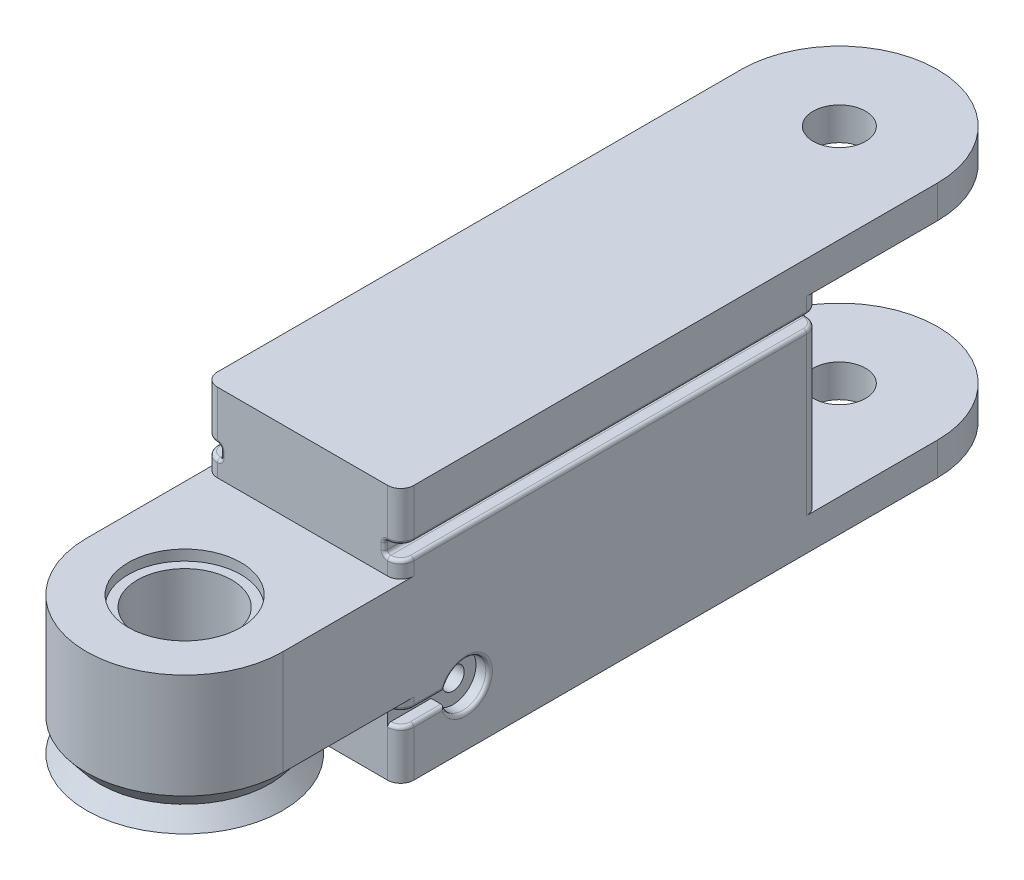
from build123d import *

# Parameters (mm, degrees)
EXTRUDE_1_DEPTH          = 8
EXTRUDE_2_DEPTH          = 5.5
EXTRUDE_2_DEPTH_BACK     = 14
CUT_EXTRUDE_1_DEPTH      = 11.5
CUT_EXTRUDE_1_DEPTH_BACK = 3
FILLET_1_R               = 1
SKETCH_5_W               = 1
SKETCH_5_H               = 1
CUT_EXTRUDE_2_DEPTH      = 5
CUT_EXTRUDE_3_REACH      = 63.051
SKETCH_6_R               = 0.5
SKETCH_7_R               = 1.75
CUT_EXTRUDE_4_DEPTH      = 1
CUT_EXTRUDE_START        = -1
SKETCH_8_R               = 1.75
CUT_EXTRUDE_5_DEPTH      = 1
CUT_EXTRUDE_6_REACH      = 53.034
SKETCH_9_W               = 1.25
SKETCH_9_H               = 1
FILLET_2_R               = 0.25
SKETCH_10_R              = 2
CUT_EXTRUDE_7_DEPTH      = 10.5
CUT_EXTRUDE_8_REACH      = 63.178
SKETCH_11_R              = 2
SKETCH_12_R              = 3.6
CUT_EXTRUDE_9_DEPTH      = 10.5
SKETCH_13_R              = 4.3
CUT_EXTRUDE_10_DEPTH     = 0.8
CUT_EXTRUDE_START_2      = -0.8
SKETCH_14_R              = 4.3
CUT_EXTRUDE_11_DEPTH     = 0.8
SKETCH_15_R              = 0.85
CUT_EXTRUDE_12_DEPTH     = 13


with BuildPart() as part:
    # 스케치1 → 보스-돌출1 (new body)
    with BuildSketch(Plane(origin=(0, 0, 0), x_dir=(1, 0, 0), z_dir=(0, 1, 0))):
        with BuildLine():
            Line((-7.5, 0), (-7.5, 50))
            ThreePointArc((-7.5, 50), (0, 57.5), (7.5, 50))
            Line((7.5, 50), (7.5, 0))
            ThreePointArc((7.5, 0), (0, -7.5), (-7.5, 0))
        make_face()
    extrude(amount=EXTRUDE_1_DEPTH)

    # 스케치2 → 회전1 (revolve)
    with BuildSketch(Plane.XY, mode=Mode.PRIVATE) as revolve_1_sk:
        Polygon((0, 0), (0, -2.5), (-7.5, -2.5), (-6.5, -1.25), (-7.5, 0), align=None)
    revolve(revolve_1_sk.sketch.rotate(Axis((0, 0, 0), (0, -1, 0)), 270), axis=Axis((0, 0, 0), (0, -1, 0)))

    # 스케치3 → 보스-돌출2 (add, two sides: drawn at the far end of the back side and taken through both)
    with BuildSketch(Plane.XZ.offset(-EXTRUDE_2_DEPTH_BACK)):
        with BuildLine():
            Line((7.5, -50), (7.5, -9))
            Line((7.5, -9), (-7.5, -9))
            Line((-7.5, -9), (-7.5, -50))
            ThreePointArc((-7.5, -50), (0, -57.5), (7.5, -50))
        make_face()
    extrude(amount=EXTRUDE_2_DEPTH + EXTRUDE_2_DEPTH_BACK)

    # 스케치4 → 컷-돌출1 (cut, two sides: drawn at the far end of the back side and taken through both)
    with BuildSketch(Plane(origin=(0, 0, 0), x_dir=(1, 0, 0), z_dir=(0, 1, 0)).offset(-CUT_EXTRUDE_1_DEPTH_BACK)):
        with BuildLine():
            Line((-7.5, 50), (-7.5, 41))
            Line((-7.5, 41), (7.5, 41))
            Line((7.5, 41), (7.5, 50))
            ThreePointArc((7.5, 50), (0, 57.5), (-7.5, 50))
        make_face()
    extrude(amount=CUT_EXTRUDE_1_DEPTH + CUT_EXTRUDE_1_DEPTH_BACK, mode=Mode.SUBTRACT)

    # 필렛1
    fillet_1_edges = [part.edges().sort_by_distance(p)[0] for p in [
        (7.5, -2.75, -9),
        (-7.5, -2.75, -9),
        (7.5, 11, -9),
        (-7.5, 11, -9),
        (-7.5, 4.25, -41),
        (7.5, 4.25, -41),
    ]]
    fillet(fillet_1_edges, radius=FILLET_1_R)

    # 스케치5 → 컷-돌출2 (cut)
    with BuildSketch(Plane.XY.offset(-9)):
        with Locations((-7, -1.25)):
            Rectangle(SKETCH_5_W, SKETCH_5_H)
        with Locations((7, -1.25)):
            Rectangle(SKETCH_5_W, SKETCH_5_H)
    extrude(amount=-CUT_EXTRUDE_2_DEPTH, mode=Mode.SUBTRACT)

    # 컷-돌출3: up to this face of the body (flat: up to its plane)
    cut_extrude_3_end = Plane(part.part.faces().sort_by_distance((-7.5, 4.25281294, -24.229254571))[0])
    # 스케치6 → 컷-돌출3 (cut, up to the picked face)
    with BuildSketch(Plane(origin=(7.5, 0, 0), x_dir=(0, 0, -1), z_dir=(1, 0, 0)), mode=Mode.PRIVATE) as cut_extrude_3_sk1:
        with Locations(Location((14, -1.25, 0), (0, 0, 90))):
            Circle(SKETCH_6_R)
    cut_extrude_3_tool1 = split(extrude(cut_extrude_3_sk1.sketch, amount=-CUT_EXTRUDE_3_REACH, mode=Mode.PRIVATE), bisect_by=cut_extrude_3_end, keep=Keep.BOTH, mode=Mode.PRIVATE)
    add(cut_extrude_3_tool1.solids().sort_by(Axis((7.5, -1.25, -14), (-1, 0, 0)))[0], mode=Mode.SUBTRACT)

    # 스케치7 → 컷-돌출4 (cut)
    with BuildSketch(Plane(origin=(7.5, 0, 0), x_dir=(0, 0, -1), z_dir=(1, 0, 0))):
        with Locations((14, -1.25)):
            Circle(SKETCH_7_R)
    extrude(amount=-CUT_EXTRUDE_4_DEPTH, mode=Mode.SUBTRACT)

    # 스케치8 → 컷-돌출5 (cut)
    with BuildSketch(Plane.ZY.offset(7.5).offset(CUT_EXTRUDE_START)):
        with Locations((-14, -1.25)):
            Circle(SKETCH_8_R)
    extrude(amount=CUT_EXTRUDE_5_DEPTH, mode=Mode.SUBTRACT)

    # 컷-돌출6: up to this face of the body (flat: up to its plane)
    cut_extrude_6_end = Plane(part.part.faces().sort_by_distance((0, 4.25, -41))[0])
    # 스케치9 → 컷-돌출6 (cut, up to the picked face)
    with BuildSketch(Plane.XY.offset(-9), mode=Mode.PRIVATE) as cut_extrude_6_sk1:
        with Locations((6.875, 9.75)):
            Rectangle(SKETCH_9_W, SKETCH_9_H)
    cut_extrude_6_tool1 = split(extrude(cut_extrude_6_sk1.sketch, amount=-CUT_EXTRUDE_6_REACH, mode=Mode.PRIVATE), bisect_by=cut_extrude_6_end, keep=Keep.BOTH, mode=Mode.PRIVATE)
    # 스케치9 → 컷-돌출6 (cut, up to the picked face)
    with BuildSketch(Plane.XY.offset(-9), mode=Mode.PRIVATE) as cut_extrude_6_sk2:
        with Locations((-6.875, 9.75)):
            Rectangle(SKETCH_9_W, SKETCH_9_H)
    cut_extrude_6_tool2 = split(extrude(cut_extrude_6_sk2.sketch, amount=-CUT_EXTRUDE_6_REACH, mode=Mode.PRIVATE), bisect_by=cut_extrude_6_end, keep=Keep.BOTH, mode=Mode.PRIVATE)
    add(cut_extrude_6_tool1.solids().sort_by(Axis((6.875, 9.75, -9), (0, 0, -1)))[0], mode=Mode.SUBTRACT)
    add(cut_extrude_6_tool2.solids().sort_by(Axis((-6.875, 9.75, -9), (0, 0, -1)))[0], mode=Mode.SUBTRACT)

    # 필렛2
    fillet_2_edges = [part.edges().sort_by_distance(p)[0] for p in [
        (7.207106781, 9.25, -40.707106781),
        (7.207106781, 9.25, -9.292893219),
        (7.207106781, 10.25, -40.707106781),
        (7.207106781, 10.25, -9.292893219),
        (7.207106781, -1.75, -9.292893219),
        (7.207106781, -0.75, -9.292893219),
        (-7.207106781, 10.25, -40.707106781),
        (-7.207106781, 10.25, -9.292893219),
        (-7.207106781, 9.25, -40.707106781),
        (-7.207106781, 9.25, -9.292893219),
        (-7.207106781, -1.75, -9.292893219),
        (-7.207106781, -0.75, -9.292893219),
        (7.5, 9.25, -25),
        (7.5, 10.25, -25),
        (7.5, -1.25, -15.75),
        (7.5, -1.75, -11.161474508),
        (7.5, -0.75, -11.161474508),
        (-7.5, 10.25, -25),
        (-7.5, 9.25, -25),
        (-7.5, -1.25, -15.75),
        (-7.5, -1.75, -11.161474508),
        (-7.5, -0.75, -11.161474508),
        (6.25, 9.75, -41),
        (6.25, 9.75, -9),
        (-6.25, 9.75, -41),
        (-6.25, 9.75, -9),
        (-6.25, 9.25, -25),
        (6.25, 10.25, -25),
        (6.25, 9.25, -25),
        (-6.25, 10.25, -25),
    ]]
    fillet(fillet_2_edges, radius=FILLET_2_R - 0.0001)  # a hair under: the kernel refuses the full size

    # 스케치10 → 컷-돌출7 (cut)
    with BuildSketch(Plane.XZ.offset(2.5)):
        with Locations(Location((0, 0, 0), (0, 0, 270))):
            Circle(SKETCH_10_R)
    extrude(amount=-CUT_EXTRUDE_7_DEPTH, mode=Mode.SUBTRACT)

    # 컷-돌출8: up to this face of the body (flat: up to its plane)
    cut_extrude_8_end = Plane(part.part.faces().sort_by_distance((0, -5.5, -32.489320458))[0])
    # 스케치11 → 컷-돌출8 (cut, up to the picked face)
    with BuildSketch(Plane(origin=(0, 14, 0), x_dir=(1, 0, 0), z_dir=(0, 1, 0)), mode=Mode.PRIVATE) as cut_extrude_8_sk1:
        with Locations(Location((0, 50, 0), (0, 0, 270))):
            Circle(SKETCH_11_R)
    cut_extrude_8_tool1 = split(extrude(cut_extrude_8_sk1.sketch, amount=-CUT_EXTRUDE_8_REACH, mode=Mode.PRIVATE), bisect_by=cut_extrude_8_end, keep=Keep.BOTH, mode=Mode.PRIVATE)
    add(cut_extrude_8_tool1.solids().sort_by(Axis((0, 14, -50), (0, -1, 0)))[0], mode=Mode.SUBTRACT)

    # 스케치12 → 컷-돌출9 (cut)
    with BuildSketch(Plane.XZ.offset(2.5)):
        with Locations(Location((0, 0, 0), (0, 0, 270))):
            Circle(SKETCH_12_R)
    extrude(amount=-CUT_EXTRUDE_9_DEPTH, mode=Mode.SUBTRACT)

    # 스케치13 → 컷-돌출10 (cut)
    with BuildSketch(Plane.XZ.offset(2.5)):
        with Locations(Location((0, 0, 0), (0, 0, 270))):
            Circle(SKETCH_13_R)
    extrude(amount=-CUT_EXTRUDE_10_DEPTH, mode=Mode.SUBTRACT)

    # 스케치14 → 컷-돌출11 (cut)
    with BuildSketch(Plane(origin=(0, 8, 0), x_dir=(1, 0, 0), z_dir=(0, 1, 0)).offset(CUT_EXTRUDE_START_2)):
        with Locations(Location((0, 0, 0), (0, 0, 90))):
            Circle(SKETCH_14_R)
    extrude(amount=CUT_EXTRUDE_11_DEPTH, mode=Mode.SUBTRACT)

    # 스케치15 → 컷-돌출12 (cut)
    with BuildSketch(Plane.ZY.offset(6.5)):
        with Locations((-14, -1.25)):
            Circle(SKETCH_15_R)
    extrude(amount=-CUT_EXTRUDE_12_DEPTH, mode=Mode.SUBTRACT)


solid = part.part
